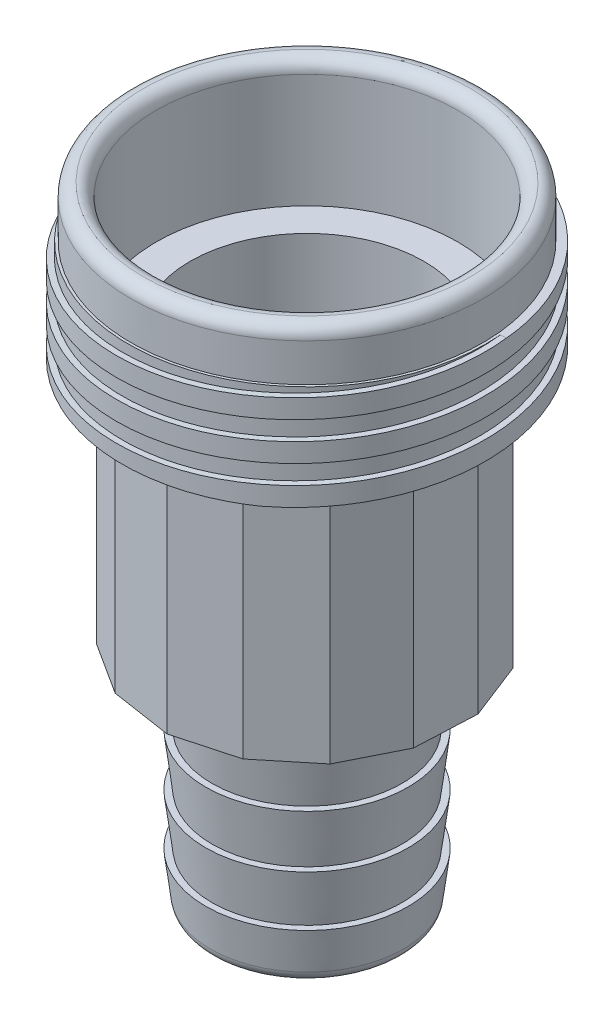
from build123d import *

# Parameters (mm, degrees)
BOSS_EXTRUDE1_DEPTH = 20
SWEEP1_PITCH        = 3
SKETCH14_W          = 3.627713581
SKETCH14_H          = 6.426235487
FILLET1_R           = 1


with BuildPart() as part:
    # Sketch1 → Boss-Extrude1 (new body)
    with BuildSketch(Plane(origin=(0, 0, 0), x_dir=(1, 0, 0), z_dir=(0, 1, 0))):
        Polygon((1.774237597, 11.622270628), (-3.106356643, 11.339119984), (-7.449833598, 9.095332482), (-10.505166645, 5.278879366), (-11.744060943, 0.549660049), (-10.952300412, -4.274600483), (-8.266787642, -8.359743758), (-4.151872186, -10.999411391), (0.680939689, -11.737180869), (5.396010905, -10.445485145), (9.178062815, -7.347670146), (11.373144284, -2.979376226), (11.601705785, 1.904078909), (9.824226957, 6.458301503), (6.348050038, 9.895825096), align=None)
    extrude(amount=BOSS_EXTRUDE1_DEPTH)

    # Sketch3 → Revolve1 (revolve)
    with BuildSketch(Plane(origin=(0, 0, 0), x_dir=(0, 0, -1), z_dir=(1, 0, 0))):
        Polygon((-7.5, -18), (0, -18), (0, 0.32454604), (-8, 0.32454604), (-8, -1.698976033), (-7.5, -5.849488017), (-8, -5.849488017), (-7.5, -10), (-8, -10), (-7.5, -14), (-8, -14), align=None)
    revolve(axis=Axis((0, 0, 0), (0, -1, 0)))

    # Sketch5 → Revolve2 (revolve)
    with BuildSketch(Plane(origin=(0, 0, 0), x_dir=(0, 0, -1), z_dir=(1, 0, 0)), mode=Mode.PRIVATE) as revolve2_sk:
        Polygon((0, 19.209651277), (-14.1, 19.209651277), (-14.1, 32.209651277), (-14, 32.209651277), (-14, 36.209651277), (0, 36.209651277), align=None)
    revolve(revolve2_sk.sketch.rotate(Axis((0, 0, 0), (0, 1, 0)), 180), axis=Axis((0, 0, 0), (0, 1, 0)))

    # Sweep1: arcs per turn and ends read off the stored shape
    # Sweep1: the profile of Sketch12 screwed along a right-hand helix through 8 turns, 10 arcs to a turn; built about Z, then put on its axis
    sweep1_z = Axis((0, 0, 0), (0, 0, 1))
    sweep1_corners = [(14.560513356, 4.0661e-05, 0.875001333), (14.060513356, 3.9264e-05, 0.875001333), (14.060513356, 3.9264e-05, -0.624998667), (14.560513356, 4.0661e-05, -0.624998667)]
    with BuildLine(mode=Mode.PRIVATE) as sweep1_profile:
        Line(sweep1_corners[0], sweep1_corners[1])
        Line(sweep1_corners[1], sweep1_corners[2])
        Line(sweep1_corners[2], sweep1_corners[3])
        Line(sweep1_corners[3], sweep1_corners[0])
    sweep1_cap = Face(sweep1_profile.wire())
    sweep1_turn_angles = [0, 18, 36, 54, 72, 90, 108, 126, 144, 162, 180, 198, 216, 234, 252, 270, 288, 306, 324, 342, 360]
    sweep1_turn_weights = [1, 0.9510565162951535, 1, 0.9510565162951535, 1, 0.9510565162951535, 1, 0.9510565162951535, 1, 0.9510565162951535, 1, 0.9510565162951535, 1, 0.9510565162951535, 1, 0.9510565162951535, 1, 0.9510565162951535, 1, 0.9510565162951535, 1]
    sweep1_turn_rails = [Edge.make_bspline([Vector(p[0], p[1], 0).rotate(sweep1_z, sweep1_turn_angles[k]) / sweep1_turn_weights[k] + Vector(0, 0, p[2] + SWEEP1_PITCH * sweep1_turn_angles[k] / 360) for k in range(21)], [0, 0, 0, 1, 1, 2, 2, 3, 3, 4, 4, 5, 5, 6, 6, 7, 7, 8, 8, 9, 9, 10, 10, 10], 2, sweep1_turn_weights) for p in sweep1_corners]
    sweep1_turn_sides = [Face.make_surface_from_curves(sweep1_turn_rails[p[0]], sweep1_turn_rails[p[1]]) for p in [(0, 1), (1, 2), (2, 3), (3, 0)]]
    sweep1 = Plane(origin=(0, 14.209651277, 0), x_dir=(0.7071067811865439, 0, 0.7071067811865512), z_dir=(0, 1, 0)) * Solid(Shell([*[p.moved(Location((0, 0, SWEEP1_PITCH * i))) for i in range(8) for p in sweep1_turn_sides], sweep1_cap, sweep1_cap.rotate(sweep1_z, 2880).moved(Location((0, 0, SWEEP1_PITCH * 2880 / 360)))]))
    add(sweep1)

    # Sketch14 → Cut-Revolve1 (revolve, cut)
    with BuildSketch(Plane(origin=(0, 0, 0), x_dir=(0, 0, -1), z_dir=(1, 0, 0)), mode=Mode.PRIVATE) as cut_revolve1_sk:
        with Locations((-13.752843826, 16.286882257)):
            Rectangle(SKETCH14_W, SKETCH14_H)
        Polygon((0, 31.5), (-13.9, 31.5), (-13.9, 27.5), (-25.441176552, 27.5), (-25.441176552, 44.73952999), (0, 44.73952999), align=None)
    revolve(cut_revolve1_sk.sketch.rotate(Axis((0, 0, 0), (0, 1, 0)), 180), axis=Axis((0, 0, 0), (0, 1, 0)), mode=Mode.SUBTRACT)

    # Sketch15 → Cut-Revolve2 (revolve, cut)
    with BuildSketch(Plane(origin=(0, 0, 0), x_dir=(0, 0, -1), z_dir=(1, 0, 0)), mode=Mode.PRIVATE) as cut_revolve2_sk:
        Polygon((-11.9, 44.395209114), (-11.9, 21.5), (-9.237180869, 21.5), (-9.237180869, 2), (-6, 2), (-6, -27.917579063), (0, -27.917579063), (0, 44.395209114), align=None)
    revolve(cut_revolve2_sk.sketch.rotate(Axis((0, -27.917579063, 0), (0, 1, 0)), 180), axis=Axis((0, -27.917579063, 0), (0, 1, 0)), mode=Mode.SUBTRACT)

    # Fillet1
    fillet1_edges = [part.edges().sort_by_distance(p)[0] for p in [
        (0, 31.5, 11.9),
        (0, -18, -7.5),
        (0, 31.5, 13.9),
    ]]
    fillet(fillet1_edges, radius=FILLET1_R - 0.0001)  # a hair under: the kernel refuses the full size


solid = part.part
